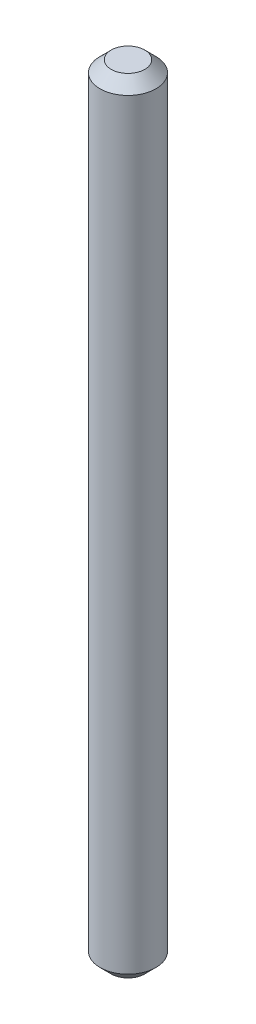
from build123d import *

# Parameters (mm, degrees)
ESQUISSE1_R        = 2.5
BOSS_EXTRU_1_DEPTH = 70
CHANFREIN1_SIZE    = 1


with BuildPart() as part:
    # Esquisse1 → Boss.-Extru.1 (new body)
    with BuildSketch(Plane(origin=(0, 0, 0), x_dir=(1, 0, 0), z_dir=(0, 1, 0))):
        Circle(ESQUISSE1_R)
    extrude(amount=BOSS_EXTRU_1_DEPTH)

    # Chanfrein1
    chanfrein1_edges = [part.edges().sort_by_distance(p)[0] for p in [
        (-2.5, 0, 0),
        (-2.5, 70, 0),
    ]]
    chamfer(chanfrein1_edges, length=CHANFREIN1_SIZE)


solid = part.part
